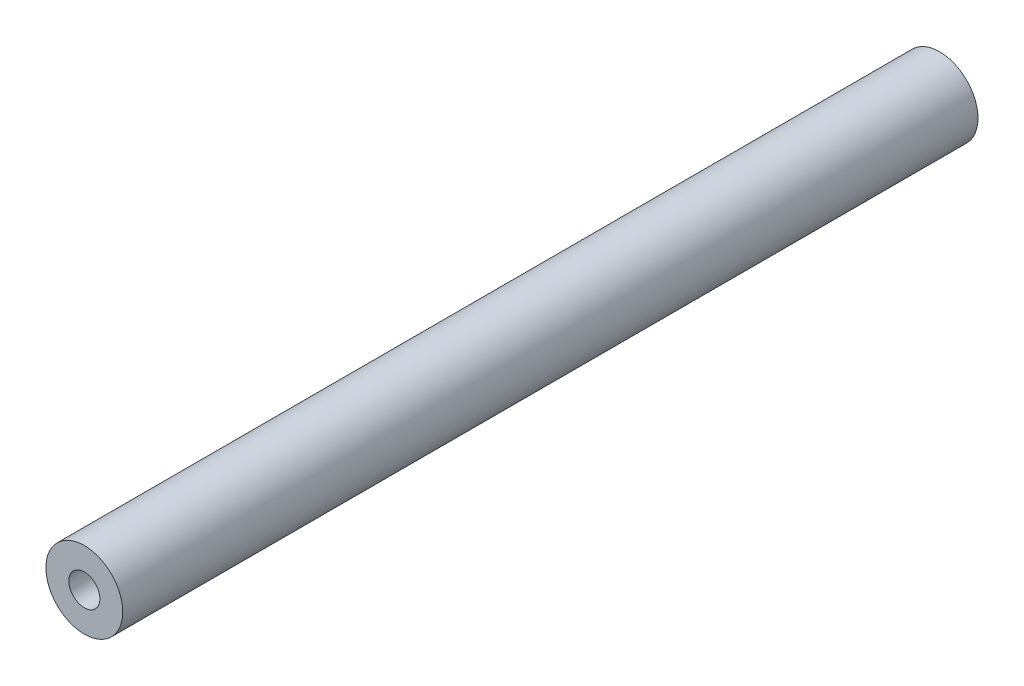
from build123d import *

# Parameters (mm, degrees)
SKETCH1_R                      = 6.4
BOSS_EXTRUDE1_DEPTH            = 142.53
F_6_0_204_DIAMETER_HOLE1_D     = 5.1816
F_6_0_204_DIAMETER_HOLE1_DEPTH = 30
F_6_0_204_DIAMETER_HOLE1_TIP   = 1.556709692
F_6_0_204_DIAMETER_HOLE2_D     = 5.1816
F_6_0_204_DIAMETER_HOLE2_DEPTH = 30
F_6_0_204_DIAMETER_HOLE2_TIP   = 1.556709692


with BuildPart() as part:
    # Sketch1 → Boss-Extrude1 (new body)
    with BuildSketch(Plane.XY):
        Circle(SKETCH1_R)
    extrude(amount=BOSS_EXTRUDE1_DEPTH)

    # #6 (0.204) Diameter Hole1
    with Locations(Plane(origin=(0, 0, 0), x_dir=(-1, 0, 0), z_dir=(0, 0, -1))):
        with Locations((0, 0)):
            Hole(F_6_0_204_DIAMETER_HOLE1_D / 2, depth=F_6_0_204_DIAMETER_HOLE1_DEPTH)
            with Locations((0, 0, -(F_6_0_204_DIAMETER_HOLE1_DEPTH + F_6_0_204_DIAMETER_HOLE1_TIP / 2))):  # 118° drill point
                Cone(0, F_6_0_204_DIAMETER_HOLE1_D / 2, F_6_0_204_DIAMETER_HOLE1_TIP, mode=Mode.SUBTRACT)

    # #6 (0.204) Diameter Hole2
    with Locations(Plane.XY.offset(142.53)):
        with Locations((0, 0)):
            Hole(F_6_0_204_DIAMETER_HOLE2_D / 2, depth=F_6_0_204_DIAMETER_HOLE2_DEPTH)
            with Locations((0, 0, -(F_6_0_204_DIAMETER_HOLE2_DEPTH + F_6_0_204_DIAMETER_HOLE2_TIP / 2))):  # 118° drill point
                Cone(0, F_6_0_204_DIAMETER_HOLE2_D / 2, F_6_0_204_DIAMETER_HOLE2_TIP, mode=Mode.SUBTRACT)


solid = part.part
